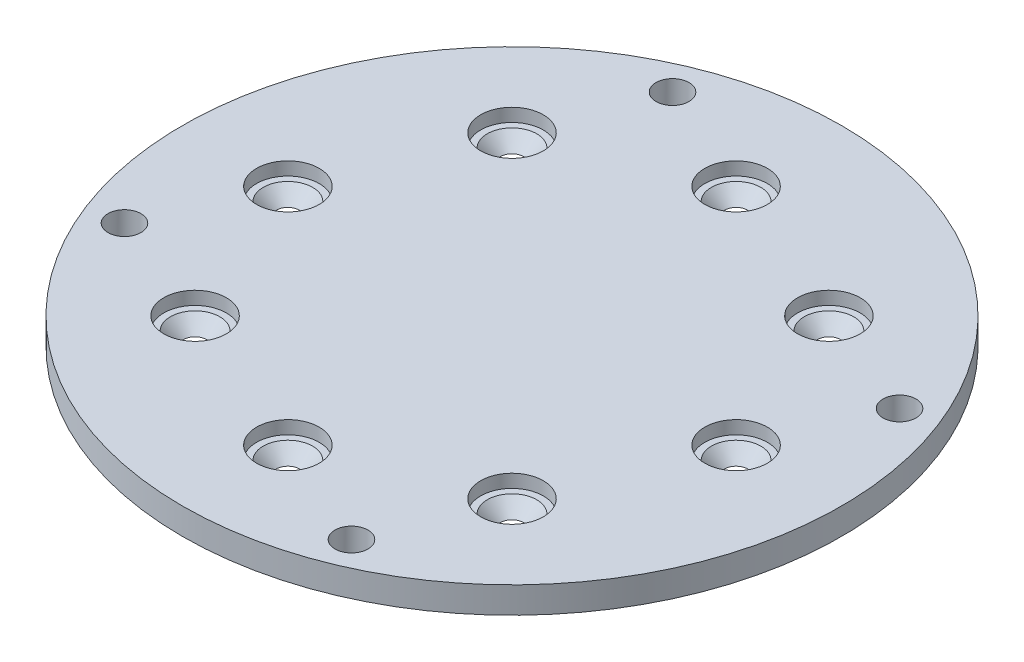
from build123d import *

# Parameters (mm, degrees)
SKETCH1_W           = 100
SKETCH1_H           = 100
BOSS_EXTRUDE1_DEPTH = 4
SKETCH2_R           = 1.75
CUT_EXTRUDE1_DEPTH  = 10
SKETCH3_OUTSIDE_W   = 130.296
SKETCH3_OUTSIDE_H   = 130.296
SKETCH3_OUTSIDE_R   = 50
CUT_EXTRUDE2_DEPTH  = 10
SKETCH4_R           = 2.5
CUT_EXTRUDE3_DEPTH  = 10
SKETCH5_R           = 4.75
CUT_EXTRUDE4_DEPTH  = 2
CHAMFER1_SIZE       = 2


with BuildPart() as part:
    # Sketch1 → Boss-Extrude1 (new body)
    with BuildSketch(Plane(origin=(0, 0, 0), x_dir=(1, 0, 0), z_dir=(0, 1, 0))):
        Rectangle(SKETCH1_W, SKETCH1_H)
    extrude(amount=BOSS_EXTRUDE1_DEPTH)

    # Sketch2 → Cut-Extrude1 (cut)
    with BuildSketch(Plane(origin=(0, 4, 0), x_dir=(1, 0, 0), z_dir=(0, 1, 0))):
        with Locations(Location((-34, 0, 0), (0, 0, 270))):
            Circle(SKETCH2_R)
        with Locations(Location((-24.04163056, 24.04163056, 0), (0, 0, 270))):
            Circle(SKETCH2_R)
        with Locations(Location((0, 34, 0), (0, 0, 270))):
            Circle(SKETCH2_R)
        with Locations(Location((24.04163056, 24.04163056, 0), (0, 0, 270))):
            Circle(SKETCH2_R)
        with Locations(Location((34, 0, 0), (0, 0, 270))):
            Circle(SKETCH2_R)
        with Locations(Location((24.04163056, -24.04163056, 0), (0, 0, 270))):
            Circle(SKETCH2_R)
        with Locations(Location((0, -34, 0), (0, 0, 270))):
            Circle(SKETCH2_R)
        with Locations(Location((-24.04163056, -24.04163056, 0), (0, 0, 270))):
            Circle(SKETCH2_R)
    extrude(amount=-CUT_EXTRUDE1_DEPTH, mode=Mode.SUBTRACT)

    # Sketch3 outside → Cut-Extrude2 (cut)
    with BuildSketch(Plane(origin=(0, 4, 0), x_dir=(1, 0, 0), z_dir=(0, 1, 0))):
        Rectangle(SKETCH3_OUTSIDE_W, SKETCH3_OUTSIDE_H)
        with Locations(Location((0, 0, 0), (0, 0, 270))):
            Circle(SKETCH3_OUTSIDE_R, mode=Mode.SUBTRACT)
    extrude(amount=-CUT_EXTRUDE2_DEPTH, mode=Mode.SUBTRACT)

    # Sketch4 → Cut-Extrude3 (cut)
    with BuildSketch(Plane(origin=(0, 4, 0), x_dir=(1, 0, 0), z_dir=(0, 1, 0))):
        with BuildLine():
            ThreePointArc((-18.177463037, 43.884277794), (-19.530453288, 40.617870382), (-16.264045876, 39.264880132))
            Line((-16.264045876, 39.264880132), (-18.177463037, 43.884277794))
        make_face()
        with BuildLine():
            Line((-18.177463037, 43.884277794), (-16.264045876, 39.264880132))
            ThreePointArc((-16.264045876, 39.264880132), (-15.142080426, 40.18565338), (-14.720754456, 41.574578963))
            ThreePointArc((-14.720754456, 41.574578963), (-15.831828874, 43.653252994), (-18.177463037, 43.884277794))
        make_face()
        with Locations(Location((41.574578963, 17.220754456, 0), (0, 0, 270))):
            Circle(SKETCH4_R)
        with Locations(Location((-41.574578963, -17.220754456, 0), (0, 0, 270))):
            Circle(SKETCH4_R)
        with Locations(Location((17.220754456, -41.574578963, 0), (0, 0, 270))):
            Circle(SKETCH4_R)
    extrude(amount=-CUT_EXTRUDE3_DEPTH, mode=Mode.SUBTRACT)

    # Sketch5 → Cut-Extrude4 (cut)
    with BuildSketch(Plane(origin=(0, 4, 0), x_dir=(1, 0, 0), z_dir=(0, 1, 0))):
        with Locations(Location((0, -34, 0), (0, 0, 270))):
            Circle(SKETCH5_R)
        with Locations(Location((24.04163056, -24.04163056, 0), (0, 0, 270))):
            Circle(SKETCH5_R)
        with Locations(Location((34, 0, 0), (0, 0, 270))):
            Circle(SKETCH5_R)
        with Locations(Location((24.04163056, 24.04163056, 0), (0, 0, 270))):
            Circle(SKETCH5_R)
        with Locations(Location((-24.04163056, -24.04163056, 0), (0, 0, 270))):
            Circle(SKETCH5_R)
        with Locations(Location((-34, 0, 0), (0, 0, 270))):
            Circle(SKETCH5_R)
        with Locations(Location((-24.04163056, 24.04163056, 0), (0, 0, 270))):
            Circle(SKETCH5_R)
        with Locations(Location((0, 34, 0), (0, 0, 270))):
            Circle(SKETCH5_R)
    extrude(amount=-CUT_EXTRUDE4_DEPTH, mode=Mode.SUBTRACT)

    # Chamfer1
    chamfer1_edges = [part.edges().sort_by_distance(p)[0] for p in [
        (0, 2, 32.25),
        (0, 2, -35.75),
        (-24.04163056, 2, -25.79163056),
        (-34, 2, -1.75),
        (24.04163056, 2, 22.29163056),
        (34, 2, -1.75),
        (24.04163056, 2, -25.79163056),
        (-24.04163056, 2, 22.29163056),
    ]]
    chamfer(chamfer1_edges, length=CHAMFER1_SIZE - 0.0001)  # a hair under: the kernel refuses the full size


solid = part.part
